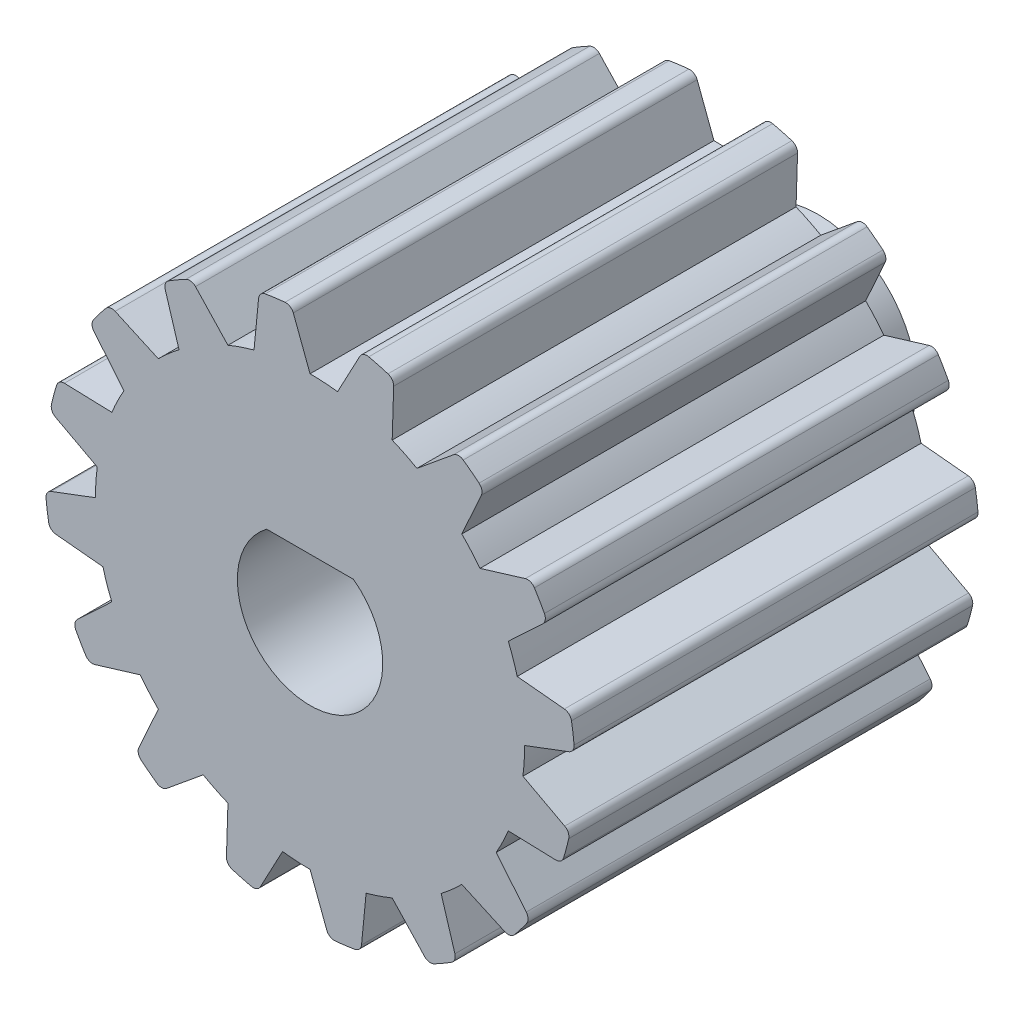
from build123d import *

# Parameters (mm, degrees)
SALIENTE_EXTRUIR1_DEPTH    = 15
CROQUIS5_R                 = 4.5
SALIENTE_EXTRUIR2_DEPTH    = 6
CORTAR_EXTRUIR1_DEPTH      = 26.166810333
ESCALA1_SCALE              = 1.5
CORTAR_EXTRUIR2_DEPTH      = 38.7502155
CORTAR_EXTRUIR2_DEPTH_BACK = 38.7502155
CORTAR_EXTRUIR3_DEPTH      = 38.7502155
CORTAR_EXTRUIR3_DEPTH_BACK = 5.8
CROQUIS7_R                 = 10
SALIENTE_EXTRUIR3_START    = 2.6
CROQUIS8_R                 = 5.5
SALIENTE_EXTRUIR3_DEPTH    = 2.6


with BuildPart() as part:
    # Croquis2 → Saliente-Extruir1 (new body)
    with BuildSketch(Plane.XY):
        with BuildLine():
            Line((-2.081696937, 7.693567449), (-1.911179214, 9.445287663))
            ThreePointArc((-1.911179214, 9.445287663), (-1.831468139, 9.618345927), (-1.663611198, 9.708496165))
            ThreePointArc((-1.663611198, 9.708496165), (-1.297642615, 9.764149919), (-0.929841298, 9.806013214))
            ThreePointArc((-0.929841298, 9.806013214), (-0.744265019, 9.762833784), (-0.622120698, 9.616601835))
            Line((-0.622120698, 9.616601835), (0, 7.97022222))
            ThreePointArc((0, 7.97022222), (0.511536449, 7.953789832), (1.020963606, 7.904560428))
            Line((1.020963606, 7.904560428), (1.848855744, 9.457684572))
            ThreePointArc((1.848855744, 9.457684572), (1.988725705, 9.587065453), (2.1783043, 9.606117341))
            ThreePointArc((2.1783043, 9.606117341), (2.537712953, 9.517484592), (2.893537451, 9.415409764))
            ThreePointArc((2.893537451, 9.415409764), (3.048463524, 9.304500205), (3.105349619, 9.122656892))
            Line((3.105349619, 9.122656892), (3.050071996, 7.363525179))
            ThreePointArc((3.050071996, 7.363525179), (3.516381649, 7.152587108), (3.968191694, 6.912155736))
            Line((3.968191694, 6.912155736), (5.327419174, 8.030234739))
            ThreePointArc((5.327419174, 8.030234739), (5.506154088, 8.09624117), (5.688592714, 8.041294232))
            ThreePointArc((5.688592714, 8.041294232), (5.986724728, 7.821868513), (6.276401353, 7.591395527))
            ThreePointArc((6.276401353, 7.591395527), (6.37709113, 7.429640815), (6.360058606, 7.239870134))
            Line((6.360058606, 7.239870134), (5.635798179, 5.635798179))
            ThreePointArc((5.635798179, 5.635798179), (5.985889619, 5.262467835), (6.311298569, 4.867437992))
            Line((6.311298569, 4.867437992), (7.994931329, 5.380254461))
            ThreePointArc((7.994931329, 5.380254461), (8.185320425, 5.372837562), (8.332844455, 5.252256971))
            ThreePointArc((8.332844455, 5.252256971), (8.524311933, 4.935443857), (8.703740045, 4.611660138))
            ThreePointArc((8.703740045, 4.611660138), (8.73486442, 4.42368596), (8.646506324, 4.254878777))
            Line((8.646506324, 4.254878777), (7.363525179, 3.050071996))
            ThreePointArc((7.363525179, 3.050071996), (7.544100156, 2.571185538), (7.693567449, 2.081696937))
            Line((7.693567449, 2.081696937), (9.445287663, 1.911179214))
            ThreePointArc((9.445287663, 1.911179214), (9.618345927, 1.831468139), (9.708496165, 1.663611198))
            ThreePointArc((9.708496165, 1.663611198), (9.764149919, 1.297642615), (9.806013214, 0.929841298))
            ThreePointArc((9.806013214, 0.929841298), (9.762833784, 0.744265019), (9.616601835, 0.622120698))
            Line((9.616601835, 0.622120698), (7.97022222, 0))
            ThreePointArc((7.97022222, 0), (7.953789832, -0.511536449), (7.904560428, -1.020963606))
            Line((7.904560428, -1.020963606), (9.457684572, -1.848855744))
            ThreePointArc((9.457684572, -1.848855744), (9.587065453, -1.988725705), (9.606117341, -2.1783043))
            ThreePointArc((9.606117341, -2.1783043), (9.517484592, -2.537712953), (9.415409764, -2.893537451))
            ThreePointArc((9.415409764, -2.893537451), (9.304500205, -3.048463524), (9.122656892, -3.105349619))
            Line((9.122656892, -3.105349619), (7.363525179, -3.050071996))
            ThreePointArc((7.363525179, -3.050071996), (7.152587108, -3.516381649), (6.912155736, -3.968191694))
            Line((6.912155736, -3.968191694), (8.030234739, -5.327419174))
            ThreePointArc((8.030234739, -5.327419174), (8.09624117, -5.506154088), (8.041294232, -5.688592714))
            ThreePointArc((8.041294232, -5.688592714), (7.821868513, -5.986724728), (7.591395527, -6.276401353))
            ThreePointArc((7.591395527, -6.276401353), (7.429640815, -6.37709113), (7.239870134, -6.360058606))
            Line((7.239870134, -6.360058606), (5.635798179, -5.635798179))
            ThreePointArc((5.635798179, -5.635798179), (5.262467835, -5.985889619), (4.867437992, -6.311298569))
            Line((4.867437992, -6.311298569), (5.380254461, -7.994931329))
            ThreePointArc((5.380254461, -7.994931329), (5.372837562, -8.185320425), (5.252256971, -8.332844455))
            ThreePointArc((5.252256971, -8.332844455), (4.935443857, -8.524311933), (4.611660138, -8.703740045))
            ThreePointArc((4.611660138, -8.703740045), (4.42368596, -8.73486442), (4.254878777, -8.646506324))
            Line((4.254878777, -8.646506324), (3.050071996, -7.363525179))
            ThreePointArc((3.050071996, -7.363525179), (2.571185538, -7.544100156), (2.081696937, -7.693567449))
            Line((2.081696937, -7.693567449), (1.911179214, -9.445287663))
            ThreePointArc((1.911179214, -9.445287663), (1.831468139, -9.618345927), (1.663611198, -9.708496165))
            ThreePointArc((1.663611198, -9.708496165), (1.297642615, -9.764149919), (0.929841298, -9.806013214))
            ThreePointArc((0.929841298, -9.806013214), (0.744265019, -9.762833784), (0.622120698, -9.616601835))
            Line((0.622120698, -9.616601835), (0, -7.97022222))
            ThreePointArc((0, -7.97022222), (-0.511536449, -7.953789832), (-1.020963606, -7.904560428))
            Line((-1.020963606, -7.904560428), (-1.848855744, -9.457684572))
            ThreePointArc((-1.848855744, -9.457684572), (-1.988725705, -9.587065453), (-2.1783043, -9.606117341))
            ThreePointArc((-2.1783043, -9.606117341), (-2.537712953, -9.517484592), (-2.893537451, -9.415409764))
            ThreePointArc((-2.893537451, -9.415409764), (-3.048463524, -9.304500205), (-3.105349619, -9.122656892))
            Line((-3.105349619, -9.122656892), (-3.050071996, -7.363525179))
            ThreePointArc((-3.050071996, -7.363525179), (-3.516381649, -7.152587108), (-3.968191694, -6.912155736))
            Line((-3.968191694, -6.912155736), (-5.327419174, -8.030234739))
            ThreePointArc((-5.327419174, -8.030234739), (-5.506154088, -8.09624117), (-5.688592714, -8.041294232))
            ThreePointArc((-5.688592714, -8.041294232), (-5.986724728, -7.821868513), (-6.276401353, -7.591395527))
            ThreePointArc((-6.276401353, -7.591395527), (-6.37709113, -7.429640815), (-6.360058606, -7.239870134))
            Line((-6.360058606, -7.239870134), (-5.635798179, -5.635798179))
            ThreePointArc((-5.635798179, -5.635798179), (-5.985889619, -5.262467835), (-6.311298569, -4.867437992))
            Line((-6.311298569, -4.867437992), (-7.994931329, -5.380254461))
            ThreePointArc((-7.994931329, -5.380254461), (-8.185320425, -5.372837562), (-8.332844455, -5.252256971))
            ThreePointArc((-8.332844455, -5.252256971), (-8.524311933, -4.935443857), (-8.703740045, -4.611660138))
            ThreePointArc((-8.703740045, -4.611660138), (-8.73486442, -4.42368596), (-8.646506324, -4.254878777))
            Line((-8.646506324, -4.254878777), (-7.363525179, -3.050071996))
            ThreePointArc((-7.363525179, -3.050071996), (-7.544100156, -2.571185538), (-7.693567449, -2.081696937))
            Line((-7.693567449, -2.081696937), (-9.445287663, -1.911179214))
            ThreePointArc((-9.445287663, -1.911179214), (-9.618345927, -1.831468139), (-9.708496165, -1.663611198))
            ThreePointArc((-9.708496165, -1.663611198), (-9.764149919, -1.297642615), (-9.806013214, -0.929841298))
            ThreePointArc((-9.806013214, -0.929841298), (-9.762833784, -0.744265019), (-9.616601835, -0.622120698))
            Line((-9.616601835, -0.622120698), (-7.97022222, 0))
            ThreePointArc((-7.97022222, 0), (-7.953789832, 0.511536449), (-7.904560428, 1.020963606))
            Line((-7.904560428, 1.020963606), (-9.457684572, 1.848855744))
            ThreePointArc((-9.457684572, 1.848855744), (-9.587065453, 1.988725705), (-9.606117341, 2.1783043))
            ThreePointArc((-9.606117341, 2.1783043), (-9.517484592, 2.537712953), (-9.415409764, 2.893537451))
            ThreePointArc((-9.415409764, 2.893537451), (-9.304500205, 3.048463524), (-9.122656892, 3.105349619))
            Line((-9.122656892, 3.105349619), (-7.363525179, 3.050071996))
            ThreePointArc((-7.363525179, 3.050071996), (-7.152587108, 3.516381649), (-6.912155736, 3.968191694))
            Line((-6.912155736, 3.968191694), (-8.030234739, 5.327419174))
            ThreePointArc((-8.030234739, 5.327419174), (-8.09624117, 5.506154088), (-8.041294232, 5.688592714))
            ThreePointArc((-8.041294232, 5.688592714), (-7.821868513, 5.986724728), (-7.591395527, 6.276401353))
            ThreePointArc((-7.591395527, 6.276401353), (-7.429640815, 6.37709113), (-7.239870134, 6.360058606))
            Line((-7.239870134, 6.360058606), (-5.635798179, 5.635798179))
            ThreePointArc((-5.635798179, 5.635798179), (-5.262467835, 5.985889619), (-4.867437992, 6.311298569))
            Line((-4.867437992, 6.311298569), (-5.380254461, 7.994931329))
            ThreePointArc((-5.380254461, 7.994931329), (-5.372837562, 8.185320425), (-5.252256971, 8.332844455))
            ThreePointArc((-5.252256971, 8.332844455), (-4.935443857, 8.524311933), (-4.611660138, 8.703740045))
            ThreePointArc((-4.611660138, 8.703740045), (-4.42368596, 8.73486442), (-4.254878777, 8.646506324))
            Line((-4.254878777, 8.646506324), (-3.050071996, 7.363525179))
            ThreePointArc((-3.050071996, 7.363525179), (-2.571185538, 7.544100156), (-2.081696937, 7.693567449))
        make_face()
    extrude(amount=SALIENTE_EXTRUIR1_DEPTH)

    # Croquis5 → Saliente-Extruir2 (add)
    with BuildSketch(Plane(origin=(0, 0, 0), x_dir=(-1, 0, 0), z_dir=(0, 0, -1))):
        Circle(CROQUIS5_R)
    extrude(amount=SALIENTE_EXTRUIR2_DEPTH)

    # Croquis3 → Cortar-Extruir1 (cut, through all)
    with BuildSketch(Plane.XY.offset(15)):
        with BuildLine():
            Line((-1.496696362, 1.68), (1.496696362, 1.68))
            ThreePointArc((1.496696362, 1.68), (0, -2.25), (-1.496696362, 1.68))
        make_face()
    extrude(amount=-CORTAR_EXTRUIR1_DEPTH, mode=Mode.SUBTRACT)


with BuildPart() as part_1:
    # Escala1: scaled about (0, 0, 0)
    add(part.part.scale(ESCALA1_SCALE))

    # Croquis6 → Cortar-Extruir2 (cut, two sides: drawn at the far end of the back side and taken through both)
    with BuildSketch(Plane.XY.offset(22.5).offset(-CORTAR_EXTRUIR2_DEPTH_BACK)):
        with BuildLine():
            Line((2.416609195, 3.25), (-2.416609195, 3.25))
            ThreePointArc((-2.416609195, 3.25), (0, -4.05), (2.416609195, 3.25))
        make_face()
    extrude(amount=CORTAR_EXTRUIR2_DEPTH + CORTAR_EXTRUIR2_DEPTH_BACK, mode=Mode.SUBTRACT)

    # Croquis7 → Cortar-Extruir3 (cut, two sides: drawn at the far end of the back side and taken through both)
    with BuildSketch(Plane(origin=(0, 0, -9), x_dir=(-1, 0, 0), z_dir=(0, 0, -1)).offset(-CORTAR_EXTRUIR3_DEPTH_BACK)):
        Circle(CROQUIS7_R)
    extrude(amount=CORTAR_EXTRUIR3_DEPTH + CORTAR_EXTRUIR3_DEPTH_BACK, mode=Mode.SUBTRACT)

    # Croquis8 → Saliente-Extruir3 (add)
    with BuildSketch(Plane(origin=(0, 0, -3.2), x_dir=(-1, 0, 0), z_dir=(0, 0, -1)).offset(SALIENTE_EXTRUIR3_START)):
        Circle(CROQUIS8_R)
        with BuildLine():
            Line((-2.416609195, 3.25), (2.416609195, 3.25))
            ThreePointArc((2.416609195, 3.25), (0, -4.05), (-2.416609195, 3.25))
        make_face(mode=Mode.SUBTRACT)
    extrude(amount=-SALIENTE_EXTRUIR3_DEPTH)


solid = part_1.part
